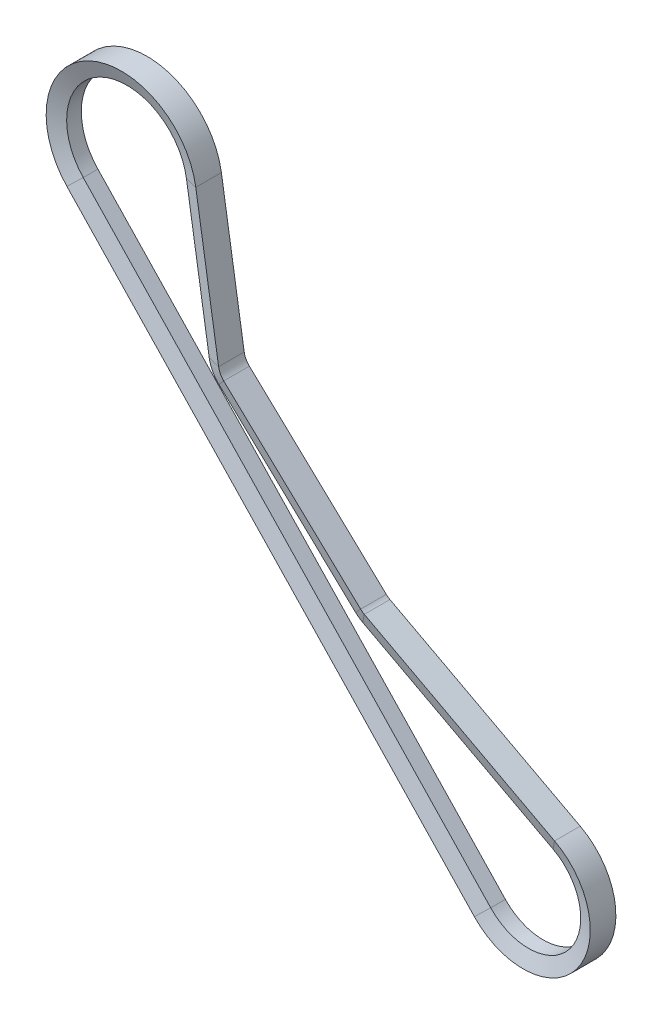
from build123d import *


with BuildPart() as part:
    # Sweep1: sweep along a path in Sketch2
    with BuildLine(Plane.XY) as sweep1_path:
        Line((-18.120536159, -17.223419211), (-169.672532673, 142.222472403))
        ThreePointArc((-169.672532673, 142.222472403), (-161.772842703, 186.619598918), (-121.722658826, 165.895392881))
        Line((-121.722658826, 165.895392881), (-113.236806226, 112.349482162))
        ThreePointArc((-113.236806226, 112.349482162), (-112.580678641, 110.379040875), (-111.323871707, 108.725687131))
        Line((-111.323871707, 108.725687131), (-60.419797507, 60.675970901))
        ThreePointArc((-60.419797507, 60.675970901), (-59.763552857, 60.13485902), (-59.040877697, 59.686306103))
        Line((-59.040877697, 59.686306103), (11.731794792, 22.076344601))
        ThreePointArc((11.731794792, 22.076344601), (19.907834211, -15.122107559), (-18.120536159, -17.223419211))
    # Sketch3 → Sweep1 (sweep)
    with BuildSketch(Plane(origin=(11.731794792, 22.076344601, 0), x_dir=(-0.46927179169133915, -0.8830537840487411, 0), z_dir=(0.8830537840487411, -0.46927179169133915, 0))):
        Polygon((0, -4.7625), (0, 4.7625), (5.588, 2.728634331), (5.588, -2.728634331), align=None)
    sweep(path=sweep1_path.line)


solid = part.part
